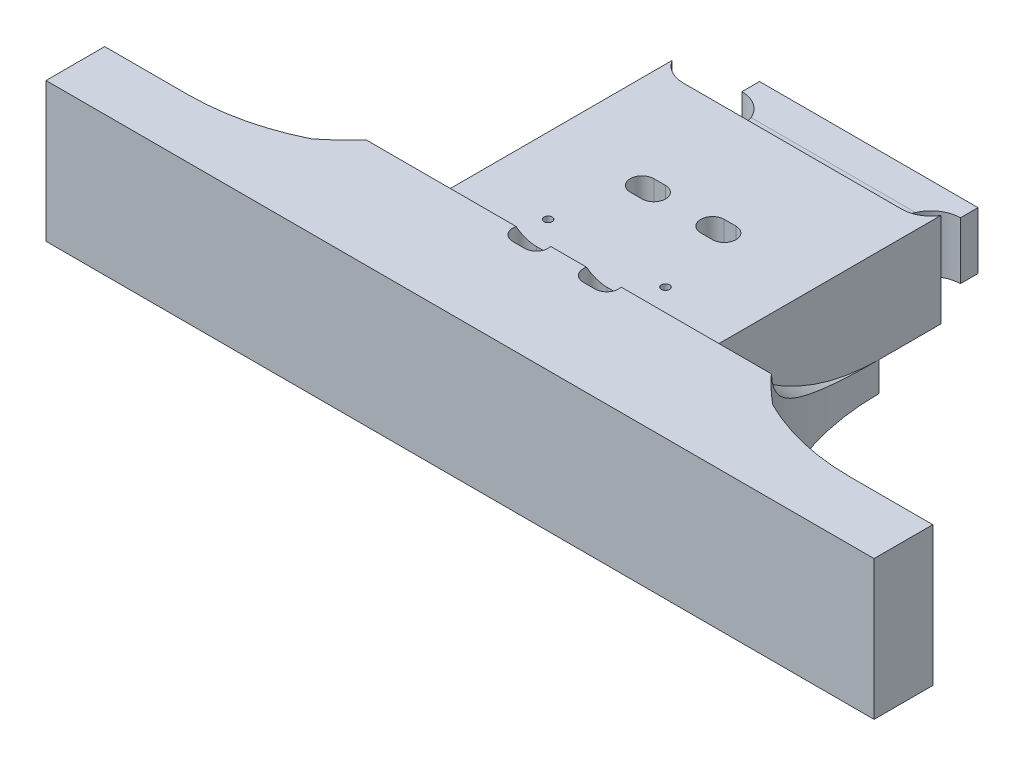
from build123d import *

# Parameters (mm, degrees)
SKETCH2_W                       = 140.99708831
SKETCH2_H                       = 23.719356628
BOSS_EXTRUDE1_DEPTH             = 40
CUT_EXTRUDE1_DEPTH              = 229.787753821
BOSS_EXTRUDE2_DEPTH             = 16
CUT_EXTRUDE2_START              = -9
CUT_EXTRUDE2_DEPTH              = 9
FILLET1_R                       = 7
CUT_EXTRUDE3_DEPTH              = 194.183131235
CUT_EXTRUDE3_DEPTH_BACK         = 194.183131235
CUT_EXTRUDE4_DEPTH              = 194.497622924
BOSS_EXTRUDE4_REACH             = 195.183
SKETCH11_W                      = 140.99708831
SKETCH11_H                      = 8.5
BOSS_EXTRUDE4_DIRECTION_2_REACH = 195.183
SKETCH14_R                      = 0.7
CUT_EXTRUDE6_DEPTH              = 4
CUT_EXTRUDE7_DEPTH              = 202.370124673


with BuildPart() as part:
    # Sketch2 → Boss-Extrude1 (new body)
    with BuildSketch(Plane.XY.offset(138.608649029)):
        with Locations((-0.054079367, 11.859678314)):
            Rectangle(SKETCH2_W, SKETCH2_H)
    extrude(amount=BOSS_EXTRUDE1_DEPTH)

    # Sketch3 → Cut-Extrude1 (cut, through all)
    with BuildSketch(Plane.ZY.offset(70.552623522)):
        with BuildLine():
            Line((168.608649029, 23.719356628), (158.608649029, 23.719356628))
            Line((158.608649029, 23.719356628), (138.608649029, 23.719356628))
            Line((138.608649029, 23.719356628), (138.608649029, 5))
            ThreePointArc((138.608649029, 5), (156.289247948, 10.063699068), (168.608649029, 23.719356628))
        make_face()
    extrude(amount=-CUT_EXTRUDE1_DEPTH, mode=Mode.SUBTRACT)

    # Sketch4 → Boss-Extrude2 (add)
    with BuildSketch(Plane(origin=(0, 5, 0), x_dir=(1, 0, 0), z_dir=(0, 1, 0))):
        with BuildLine():
            Line((-22.924910668, -128.108649029), (-22.924910668, -168.608649029))
            Line((-22.924910668, -168.608649029), (-0.054079367, -168.608649029))
            Line((-0.054079367, -168.608649029), (22.816751934, -168.608649029))
            Line((22.816751934, -168.608649029), (22.816751934, -128.108649029))
            ThreePointArc((22.816751934, -128.108649029), (14.187021689, -127.958138772), (18.545920633, -120.508649029))
            Line((18.545920633, -120.508649029), (18.545920633, -117.508649029))
            Line((18.545920633, -117.508649029), (-18.654079367, -117.508649029))
            Line((-18.654079367, -117.508649029), (-18.654079367, -120.508649029))
            ThreePointArc((-18.654079367, -120.508649029), (-15.118545461, -121.973115123), (-13.654079367, -125.508649029))
            ThreePointArc((-13.654079367, -125.508649029), (-17.303923173, -130.322906838), (-22.924910668, -128.108649029))
        make_face()
    extrude(amount=BOSS_EXTRUDE2_DEPTH)

    # Sketch6 → Cut-Extrude2 (cut)
    with BuildSketch(Plane(origin=(0, 23.719356628, 0), x_dir=(1, 0, 0), z_dir=(0, 1, 0)).offset(CUT_EXTRUDE2_START)):
        with BuildLine():
            ThreePointArc((-18.654079367, -120.508649029), (-13.654079367, -125.508649029), (-18.654079367, -130.508649029))
            Line((-18.654079367, -130.508649029), (18.545920633, -130.508649029))
            ThreePointArc((18.545920633, -130.508649029), (13.545920633, -125.508649029), (18.545920633, -120.508649029))
            Line((18.545920633, -120.508649029), (18.545920633, -117.508649029))
            Line((18.545920633, -117.508649029), (-18.654079367, -117.508649029))
            Line((-18.654079367, -117.508649029), (-18.654079367, -120.508649029))
        make_face()
    extrude(amount=CUT_EXTRUDE2_DEPTH, mode=Mode.SUBTRACT)

    # Fillet1
    # the kernel refuses this fillet: 7 mm, written as the material it adds along each edge
    with BuildSketch(Plane(origin=(-36.061428038, 14.719356628, 130.508649029), x_dir=(0, 1, 0), z_dir=(1, 0, 0))) as fillet1_piece_1_section:
        with BuildLine():
            CenterArc((7, -6.962939469), FILLET1_R, 95.898427251, 84.101572749)
            Line((0, -6.962939469), (0, 0))
            Line((0, 0), (6.280643372, 0))
        make_face()
    fillet1_piece_1 = extrude(amount=72.014697343, mode=Mode.PRIVATE)
    fillet1_piece_1 = split(fillet1_piece_1, bisect_by=Plane(origin=(22.816751934, 16.511100944, 128.243610021), z_dir=(-1, 0, 0)), keep=Keep.TOP, mode=Mode.PRIVATE)
    fillet1_piece_1 = split(fillet1_piece_1, bisect_by=Plane(origin=(-22.924910668, 16.511100944, 128.243610021), z_dir=(1, 0, 0)), keep=Keep.TOP, mode=Mode.PRIVATE)
    fillet1_piece_1 = fillet1_piece_1 - Plane(origin=(18.545920633, 16.511100944, 125.508649029), x_dir=(0.854166260162501, 0, 0.5200000000000065), z_dir=(0, -1, 0)) * Cylinder(5, 172, mode=Mode.PRIVATE)
    fillet1_piece_1 = fillet1_piece_1 - Plane(origin=(-18.654079367, 16.511100944, 125.508649029), x_dir=(0, 0, -1), z_dir=(0, -1, 0)) * Cylinder(5, 172, mode=Mode.PRIVATE)
    add(fillet1_piece_1)

    # Sketch10 → Cut-Extrude3 (cut, two sides: drawn at the far end of the back side and taken through both)
    with BuildSketch(Plane(origin=(0, 21, 0), x_dir=(1, 0, 0), z_dir=(0, 1, 0)).offset(-CUT_EXTRUDE3_DEPTH_BACK)):
        with BuildLine():
            Line((-70.552623522, -168.608649029), (-70.552623522, -172.108649029))
            Line((-70.552623522, -172.108649029), (-56.424910668, -172.108649029))
            ThreePointArc((-56.424910668, -172.108649029), (-32.736833498, -162.296726199), (-22.924910668, -138.608649029))
            Line((-22.924910668, -138.608649029), (-70.552623522, -138.608649029))
            Line((-70.552623522, -138.608649029), (-70.552623522, -168.608649029))
        make_face()
        with BuildLine():
            ThreePointArc((22.816751934, -138.608649029), (32.628674764, -162.296726199), (56.316751934, -172.108649029))
            Line((56.316751934, -172.108649029), (70.444464788, -172.108649029))
            Line((70.444464788, -172.108649029), (70.444464788, -168.608649029))
            Line((70.444464788, -168.608649029), (70.444464788, -138.608649029))
            Line((70.444464788, -138.608649029), (22.816751934, -138.608649029))
        make_face()
    extrude(amount=CUT_EXTRUDE3_DEPTH + CUT_EXTRUDE3_DEPTH_BACK, mode=Mode.SUBTRACT)

    # Sketch12 → Cut-Extrude4 (cut, through all)
    with BuildSketch(Plane(origin=(0, 23.719356628, 0), x_dir=(1, 0, 0), z_dir=(0, 1, 0))):
        with BuildLine():
            ThreePointArc((39.183618102, -173.086260969), (47.517265008, -176.089564571), (56.316751934, -177.108649029))
            Line((56.316751934, -177.108649029), (70.444464788, -177.108649029))
            Line((70.444464788, -177.108649029), (70.444464788, -172.108649029))
            Line((70.444464788, -172.108649029), (56.316751934, -172.108649029))
            ThreePointArc((56.316751934, -172.108649029), (32.628674764, -162.296726199), (22.816751934, -138.608649029))
            ThreePointArc((22.816751934, -138.608649029), (27.116175744, -157.691232929), (39.183618102, -173.086260969))
        make_face()
        with BuildLine():
            Line((-70.552623522, -172.108649029), (-70.552623522, -177.108649029))
            Line((-70.552623522, -177.108649029), (-56.424910668, -177.108649029))
            ThreePointArc((-56.424910668, -177.108649029), (-47.625423742, -176.089564571), (-39.291776836, -173.086260969))
            ThreePointArc((-39.291776836, -173.086260969), (-27.224334478, -157.691232929), (-22.924910668, -138.608649029))
            ThreePointArc((-22.924910668, -138.608649029), (-32.736833498, -162.296726199), (-56.424910668, -172.108649029))
            Line((-56.424910668, -172.108649029), (-70.552623522, -172.108649029))
        make_face()
    extrude(amount=-CUT_EXTRUDE4_DEPTH, mode=Mode.SUBTRACT)

    # Boss-Extrude4: up to this face of the body (flat: up to its plane)
    boss_extrude4_end = Plane(part.part.faces().sort_by_distance((-0.054079367, 23.719356628, 174.251451193))[0])
    # Sketch11 → Boss-Extrude4 (add, up to the picked face)
    with BuildSketch(Plane(origin=(0, 21, 0), x_dir=(1, 0, 0), z_dir=(0, 1, 0)), mode=Mode.PRIVATE) as boss_extrude4_sk1:
        with Locations((-0.054079367, -182.858649029)):
            Rectangle(SKETCH11_W, SKETCH11_H)
    boss_extrude4_tool1 = split(extrude(boss_extrude4_sk1.sketch, amount=BOSS_EXTRUDE4_REACH, mode=Mode.PRIVATE), bisect_by=boss_extrude4_end, keep=Keep.BOTH, mode=Mode.PRIVATE)
    add(boss_extrude4_tool1.solids().sort_by(Axis((-0.054079, 21, 182.858649), (0, 1, 0)))[0])

    # Boss-Extrude4 direction 2: up to this face of the body (flat: up to its plane)
    boss_extrude4_direction_2_end = Plane(part.part.faces().sort_by_distance((-0.054079367, 0, 161.750198619))[0])
    # Sketch11 → Boss-Extrude4 direction 2 (add, up to the picked face)
    with BuildSketch(Plane(origin=(0, 21, 0), x_dir=(1, 0, 0), z_dir=(0, 1, 0)), mode=Mode.PRIVATE) as boss_extrude4_direction_2_sk1:
        with Locations((-0.054079367, -182.858649029)):
            Rectangle(SKETCH11_W, SKETCH11_H)
    boss_extrude4_direction_2_tool1 = split(extrude(boss_extrude4_direction_2_sk1.sketch, amount=-BOSS_EXTRUDE4_DIRECTION_2_REACH, mode=Mode.PRIVATE), bisect_by=boss_extrude4_direction_2_end, keep=Keep.BOTH, mode=Mode.PRIVATE)
    add(boss_extrude4_direction_2_tool1.solids().sort_by(Axis((-0.054079, 21, 182.858649), (0, -1, 0)))[0])

    # Sketch14 → Cut-Extrude6 (cut)
    with BuildSketch(Plane(origin=(0, 21, 0), x_dir=(1, 0, 0), z_dir=(0, 1, 0))):
        with Locations(Location((-10.054079367, -162.11771624, 0), (0, 0, 270))):
            Circle(SKETCH14_R)
        with Locations(Location((9.945920633, -162.11771624, 0), (0, 0, 90))):
            Circle(SKETCH14_R)
    extrude(amount=-CUT_EXTRUDE6_DEPTH, mode=Mode.SUBTRACT)

    # Sketch16 → Cut-Extrude7 (cut, through all)
    with BuildSketch(Plane(origin=(0, 23.719356628, 0), x_dir=(1, 0, 0), z_dir=(0, 1, 0))):
        with BuildLine():
            Line((-7.054079367, -151.11771624), (-5.054079367, -151.11771624))
            ThreePointArc((-5.054079367, -151.11771624), (-3.054079367, -149.11771624), (-5.054079367, -147.11771624))
            Line((-5.054079367, -147.11771624), (-7.054079367, -147.11771624))
            ThreePointArc((-7.054079367, -147.11771624), (-9.054079367, -149.11771624), (-7.054079367, -151.11771624))
        make_face()
        with BuildLine():
            ThreePointArc((4.945920633, -151.11771624), (2.945920633, -149.11771624), (4.945920633, -147.11771624))
            Line((4.945920633, -147.11771624), (6.945920633, -147.11771624))
            ThreePointArc((6.945920633, -147.11771624), (8.945920633, -149.11771624), (6.945920633, -151.11771624))
            Line((6.945920633, -151.11771624), (4.945920633, -151.11771624))
        make_face()
        with BuildLine():
            Line((4.945920633, -171.11771624), (6.945920633, -171.11771624))
            ThreePointArc((6.945920633, -171.11771624), (8.529924172, -170.338753827), (8.880048492, -168.608649029))
            Line((8.880048492, -168.608649029), (3.011792774, -168.608649029))
            ThreePointArc((3.011792774, -168.608649029), (3.361917094, -170.338753827), (4.945920633, -171.11771624))
        make_face()
        with BuildLine():
            Line((3.011792774, -168.608649029), (8.880048492, -168.608649029))
            ThreePointArc((8.880048492, -168.608649029), (8.16695822, -167.533712701), (6.945920633, -167.11771624))
            Line((6.945920633, -167.11771624), (4.945920633, -167.11771624))
            ThreePointArc((4.945920633, -167.11771624), (3.724883046, -167.533712701), (3.011792774, -168.608649029))
        make_face()
        with BuildLine():
            Line((-8.988207226, -168.608649029), (-3.119951508, -168.608649029))
            ThreePointArc((-3.119951508, -168.608649029), (-3.83304178, -167.533712701), (-5.054079367, -167.11771624))
            Line((-5.054079367, -167.11771624), (-7.054079367, -167.11771624))
            ThreePointArc((-7.054079367, -167.11771624), (-8.275116954, -167.533712701), (-8.988207226, -168.608649029))
        make_face()
        with BuildLine():
            ThreePointArc((-5.054079367, -171.11771624), (-3.470075828, -170.338753827), (-3.119951508, -168.608649029))
            Line((-3.119951508, -168.608649029), (-8.988207226, -168.608649029))
            ThreePointArc((-8.988207226, -168.608649029), (-8.638082906, -170.338753827), (-7.054079367, -171.11771624))
            Line((-7.054079367, -171.11771624), (-5.054079367, -171.11771624))
        make_face()
    extrude(amount=-CUT_EXTRUDE7_DEPTH, mode=Mode.SUBTRACT)


solid = part.part
